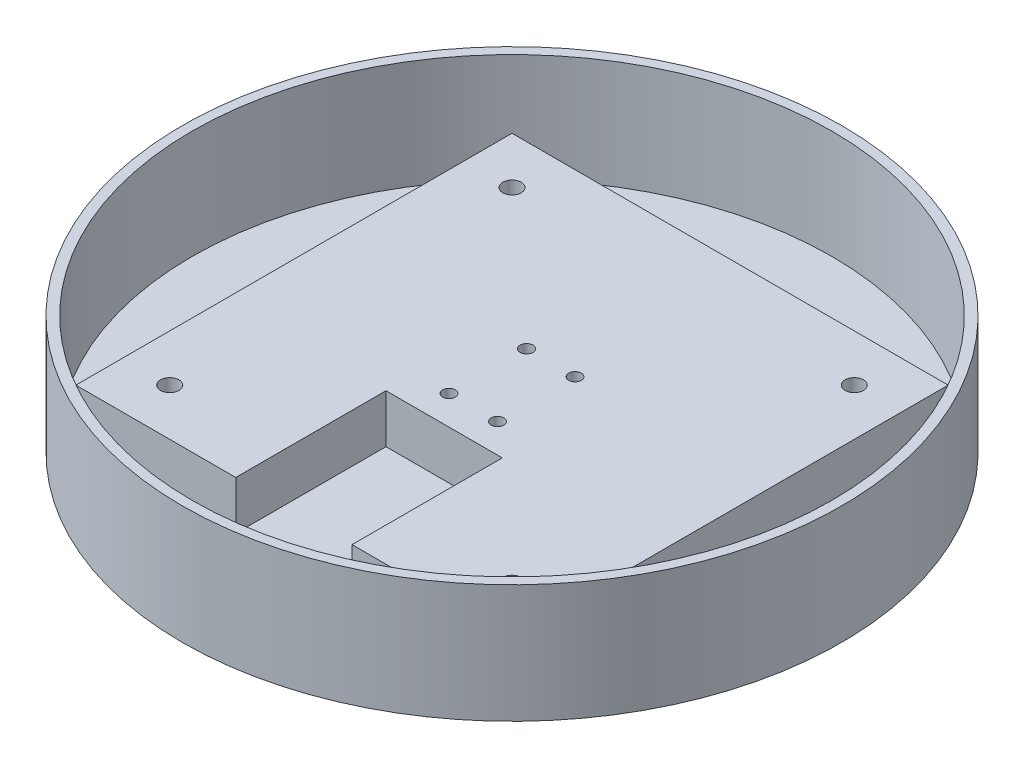
from build123d import *

# Parameters (mm, degrees)
SKETCH1_R           = 86.36
SKETCH1_R_2         = 83.82
BOSS_EXTRUDE1_DEPTH = 28.45
BOSS_EXTRUDE2_START = -2.54
SKETCH1_2_R         = 86.36
SKETCH1_2_R_2       = 83.82
BOSS_EXTRUDE2_DEPTH = 2.54
SKETCH2_R           = 2.413
BOSS_EXTRUDE3_DEPTH = 12.7
SKETCH3_R           = 1.651
SKETCH3_R_2         = 1.681286521
CUT_EXTRUDE1_DEPTH  = 2.54


with BuildPart() as part:
    # Sketch1 → Boss-Extrude1 (new body)
    with BuildSketch(Plane(origin=(0, 0, 0), x_dir=(1, 0, 0), z_dir=(0, 1, 0))):
        Circle(SKETCH1_R)
        Circle(SKETCH1_R_2, mode=Mode.SUBTRACT)
    extrude(amount=BOSS_EXTRUDE1_DEPTH)

    # Sketch1<2> → Boss-Extrude2 (add)
    # profile 1 of 2: a face of its own
    with BuildSketch(Plane(origin=(0, 0, 0), x_dir=(1, 0, 0), z_dir=(0, 1, 0)).offset(BOSS_EXTRUDE2_START)):
        Circle(SKETCH1_2_R)
        Circle(SKETCH1_2_R_2, mode=Mode.SUBTRACT)
    # profile 2 of 2: a face of its own
    with BuildSketch(Plane(origin=(0, 0, 0), x_dir=(1, 0, 0), z_dir=(0, 1, 0)).offset(BOSS_EXTRUDE2_START)):
        Circle(SKETCH1_2_R_2)
    extrude(amount=BOSS_EXTRUDE2_DEPTH)

    # Sketch2 → Boss-Extrude3 (add)
    with BuildSketch(Plane(origin=(0, 0, 0), x_dir=(1, 0, 0), z_dir=(0, 1, 0))):
        Polygon((-57.15, -57.15), (-15.24, -57.15), (-15.24, -17.78), (15.24, -17.78), (15.24, -57.15), (57.15, -57.15), (57.15, 57.15), (-57.15, 57.15), align=None)
        with Locations((44.845, 44.845)):
            Circle(SKETCH2_R, mode=Mode.SUBTRACT)
        with Locations((44.845, -44.845)):
            Circle(SKETCH2_R, mode=Mode.SUBTRACT)
        with Locations((-44.845, -44.845)):
            Circle(SKETCH2_R, mode=Mode.SUBTRACT)
        with Locations((-44.845, 44.845)):
            Circle(SKETCH2_R, mode=Mode.SUBTRACT)
    extrude(amount=BOSS_EXTRUDE3_DEPTH)

    # Sketch3 → Cut-Extrude1 (cut)
    with BuildSketch(Plane(origin=(0, 12.7, 0), x_dir=(1, 0, 0), z_dir=(0, 1, 0))):
        with Locations((6.35, 10.16)):
            Circle(SKETCH3_R)
        with Locations((6.35, -10.16)):
            Circle(SKETCH3_R)
        with Locations((-6.35, -10.16)):
            Circle(SKETCH3_R)
        with Locations((-6.35, 10.16)):
            Circle(SKETCH3_R_2)
    extrude(amount=-CUT_EXTRUDE1_DEPTH, mode=Mode.SUBTRACT)


solid = part.part
